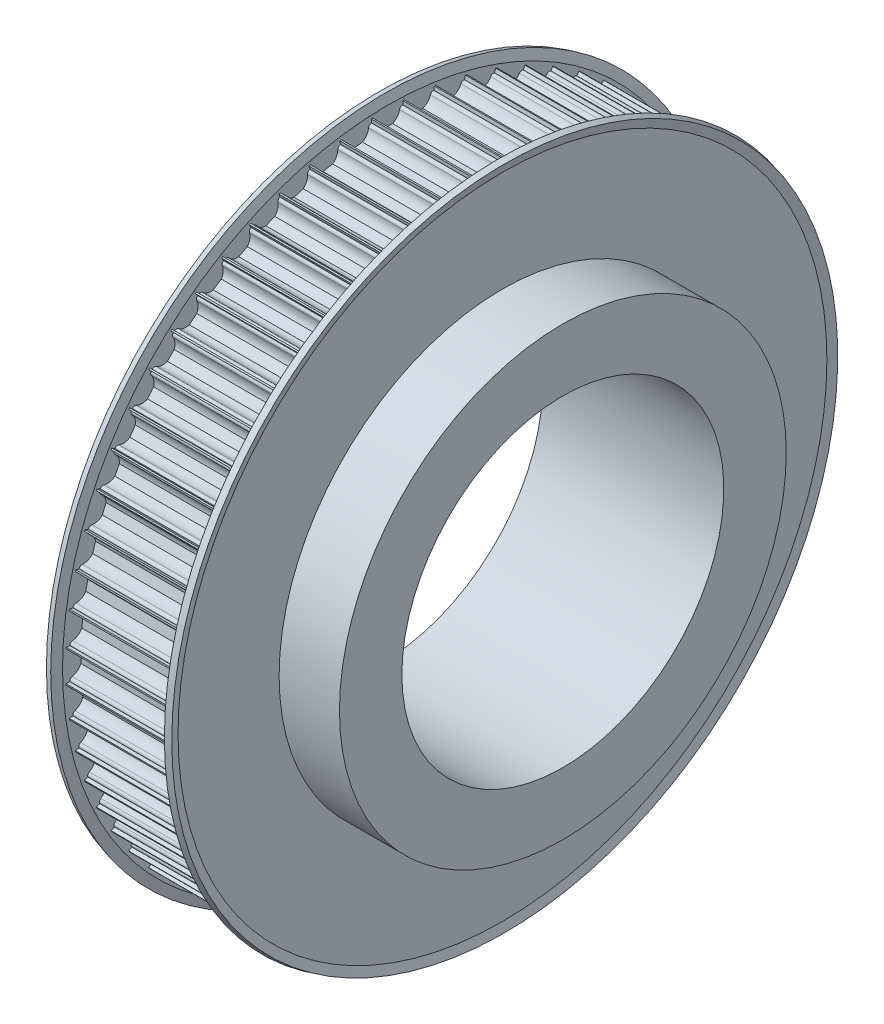
from build123d import *

# Parameters (mm, degrees)
CUT_EXTRUDE1_REACH = 123.758
CIRPATTERN1_COUNT  = 64


with BuildPart() as part:
    # Sketch1 → Revolve1 (revolve)
    with BuildSketch(Plane.XY):
        Polygon((0, 68.819440402), (0, 40), (45, 40), (45, 55.5), (30, 55.5), (30, 80), (0, 80), align=None)
    revolve(axis=Axis((0, 0, 0), (1, 0, 0)))

    # Sketch2 → Cut-Extrude1 (cut, up to next)
    with BuildSketch(Plane.ZY, mode=Mode.PRIVATE) as cut_extrude1_sk1:
        with BuildLine():
            Line((3.674234614, 79), (3.75, 79))
            Line((3.75, 79), (3.75, 81))
            Line((3.75, 81), (-3.75, 81))
            Line((-3.75, 81), (-3.75, 79))
            Line((-3.75, 79), (-3.674234614, 79))
            ThreePointArc((-3.674234614, 79), (-3.199892965, 78.830947502), (-2.939387691, 78.4))
            ThreePointArc((-2.939387691, 78.4), (-2.331759211, 77.112435701), (-1.198957881, 76.25))
            Line((-1.198957881, 76.25), (1.198957881, 76.25))
            ThreePointArc((1.198957881, 76.25), (2.331759211, 77.112435701), (2.939387691, 78.4))
            ThreePointArc((2.939387691, 78.4), (3.199892965, 78.830947502), (3.674234614, 79))
        make_face()
    cut_extrude1_tool1 = extrude(cut_extrude1_sk1.sketch, amount=-CUT_EXTRUDE1_REACH, mode=Mode.PRIVATE) & part.part
    cut_extrude1 = cut_extrude1_tool1.solids().sort_by_distance((0, 78.935169, 0))[0]
    add(cut_extrude1, mode=Mode.SUBTRACT)

    # CirPattern1: Cut-Extrude1 ×64 about axis
    cirpattern1_axis = Axis((0, 0, 0), (-1, 0, 0))
    for i in range(1, CIRPATTERN1_COUNT):
        add(cut_extrude1.rotate(cirpattern1_axis, i * 360 / CIRPATTERN1_COUNT), mode=Mode.SUBTRACT)

    # Sketch3 → Revolve2 (revolve)
    with BuildSketch(Plane.XY):
        Polygon((30, 55.5), (30, 80.61), (30.570054448, 82.737472162), (29.121165708, 83.125700729), (28.5, 80.807478746), (28.5, 55.5), align=None)
        Polygon((1.5, 80.807478746), (1.5, 55.5), (0, 55.5), (0, 80.61), (-0.570054448, 82.737472162), (0.878834292, 83.125700729), align=None)
    revolve(axis=Axis((0, 0, 0), (1, 0, 0)))


solid = part.part
